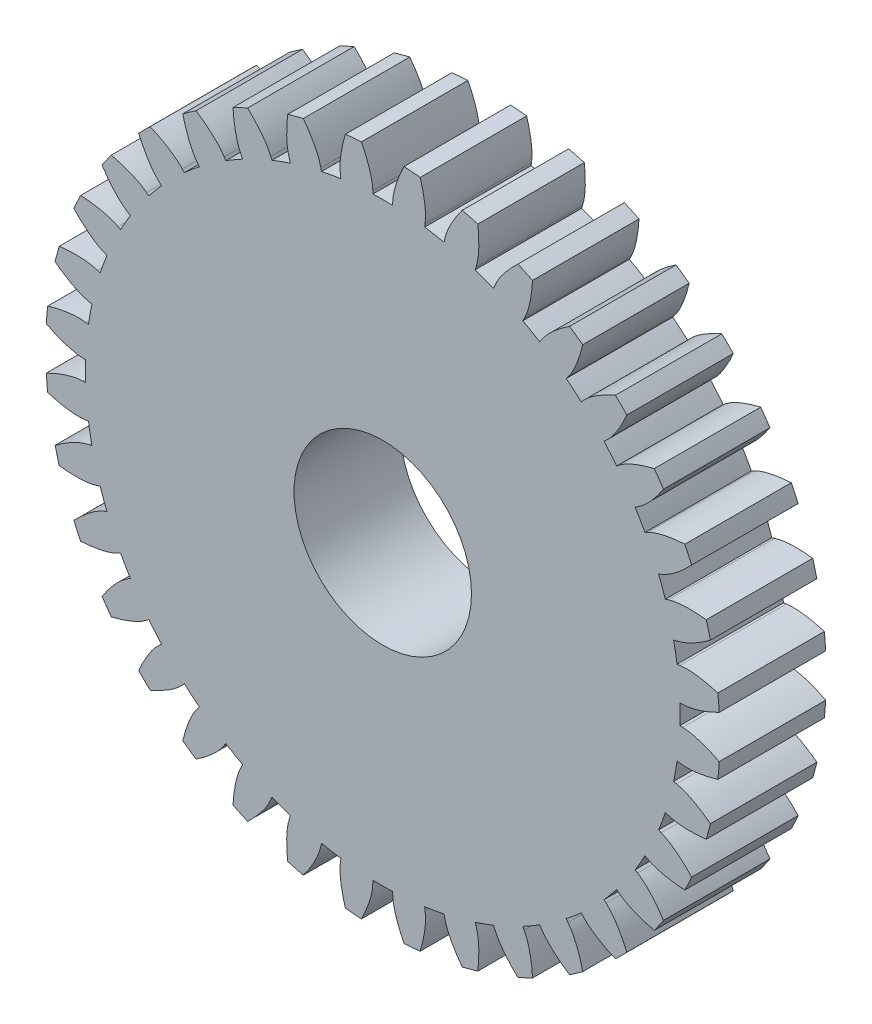
from build123d import *

# Parameters (mm, degrees)
SKETCH_1_R               = 3.8
SKETCH_1_R_2             = 1
EXTRUDE_1_DEPTH          = 1.2
CUT_EXTRUDE_1_DEPTH      = 6.506359959
PATTERN_CIRCULAR_1_COUNT = 36
PATTERN_CIRCULAR_1_ANGLE = 350


with BuildPart() as part:
    # 草图1 → 凸台-拉伸1 (new body)
    with BuildSketch(Plane.XY):
        Circle(SKETCH_1_R)
        Circle(SKETCH_1_R_2, mode=Mode.SUBTRACT)
    extrude(amount=EXTRUDE_1_DEPTH)

    # 草图1<3> → 切除-拉伸1 (cut, through all)
    with BuildSketch(Plane.XY):
        with BuildLine():
            Line((3.381038299, 0.112017913), (3.348162902, 0.110928711))
            ThreePointArc((3.348162902, 0.110928711), (3.349540694, 0.055471961), (3.35, 0))
            ThreePointArc((3.35, 0), (3.349540694, -0.055471961), (3.348162902, -0.110928711))
            Line((3.348162902, -0.110928711), (3.381038299, -0.112017913))
            add(Edge.make_bspline(
                [(3.381038299, -0.112017913), (3.406811039, -0.112871795), (3.478556811, -0.120611209), (3.583956612, -0.149064045), (3.68519278, -0.188588845), (3.760002966, -0.223996363), (3.792383744, -0.240469415)],
                knots=[0, 0, 0, 0, 0, 0.005604068, 0.015718248, 0.023635274, 0.023635274, 0.023635274, 0.023635274, 0.023635274], degree=4))
            ThreePointArc((3.792383744, -0.240469415), (3.798095459, -0.120294999), (3.8, 0))
            ThreePointArc((3.8, 0), (3.798095459, 0.120294999), (3.792383744, 0.240469415))
            add(Edge.make_bspline(
                [(3.381038299, 0.112017913), (3.406811039, 0.112871795), (3.478556811, 0.120611209), (3.583956612, 0.149064045), (3.68519278, 0.188588845), (3.760002966, 0.223996363), (3.792383744, 0.240469415)],
                knots=[0, 0, 0, 0, 0, 0.005604068, 0.015718248, 0.023635274, 0.023635274, 0.023635274, 0.023635274, 0.023635274], degree=4))
        make_face()
    cut_extrude_1 = extrude(amount=CUT_EXTRUDE_1_DEPTH, mode=Mode.SUBTRACT)

    # 阵列(圆周)1: 切除-拉伸1 ×36 about axis
    pattern_circular_1_axis = Axis((0, 0, 1.2), (0, 0, 1))
    for i in range(1, PATTERN_CIRCULAR_1_COUNT):
        add(cut_extrude_1.rotate(pattern_circular_1_axis, i * PATTERN_CIRCULAR_1_ANGLE / (PATTERN_CIRCULAR_1_COUNT - 1)), mode=Mode.SUBTRACT)


solid = part.part
